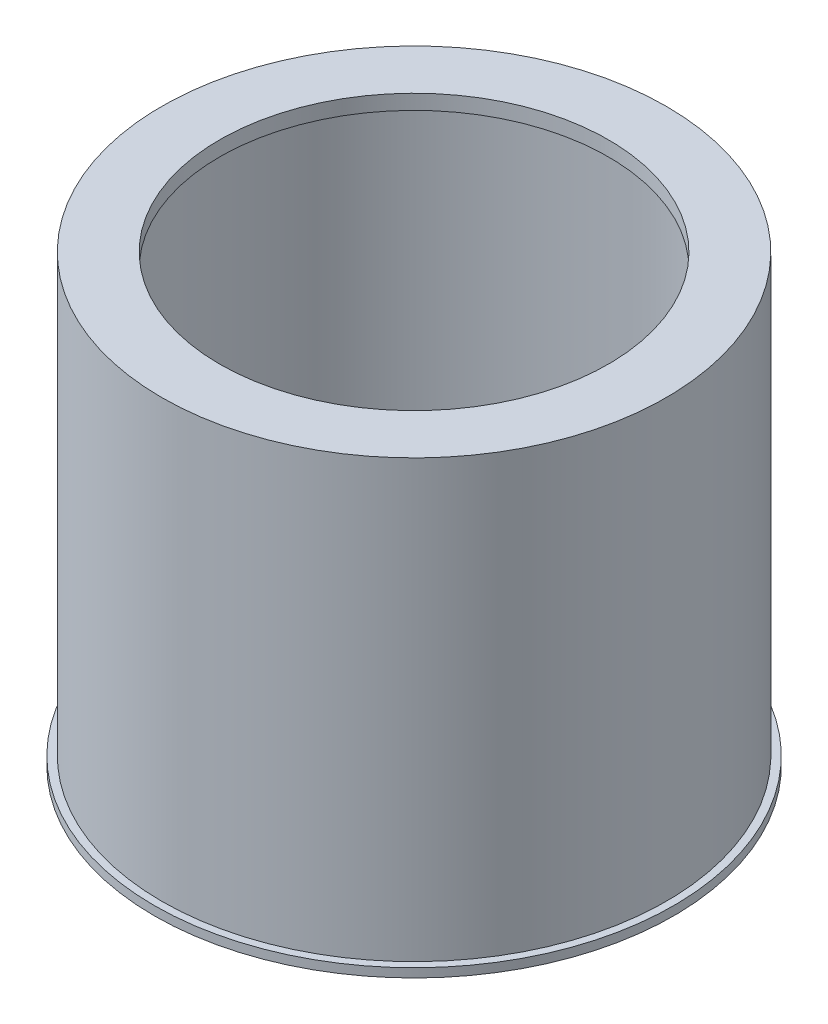
from build123d import *

# Parameters (mm, degrees)
RECEPTACLE_FLOOR_SKETCH_R   = 175
RECEPTACLE_FLOOR_SKETCH_R_2 = 12.5
RECEPTACLE_FLOOR_DEPTH      = 6
RECEPTACLE_WALL_SKETCH_R    = 170
RECEPTACLE_WALL_SKETCH_R_2  = 166
RECEPTACLE_WALL_DEPTH       = 300
POT_START                   = 290
POT_SEAT_LEDGE_SKETCH_R     = 167
POT_SEAT_LEDGE_SKETCH_R_2   = 131
POT_SEAT_LEDGE_DEPTH        = 10


with BuildPart() as part:
    # Receptacle Floor Sketch → Receptacle Floor (new body)
    with BuildSketch(Plane(origin=(0, 0, 0), x_dir=(1, 0, 0), z_dir=(0, 1, 0))):
        Circle(RECEPTACLE_FLOOR_SKETCH_R)
        Circle(RECEPTACLE_FLOOR_SKETCH_R_2, mode=Mode.SUBTRACT)
    extrude(amount=RECEPTACLE_FLOOR_DEPTH)

    # Receptacle Wall Sketch → Receptacle Wall (add)
    with BuildSketch(Plane(origin=(0, 0, 0), x_dir=(1, 0, 0), z_dir=(0, 1, 0))):
        Circle(RECEPTACLE_WALL_SKETCH_R)
        Circle(RECEPTACLE_WALL_SKETCH_R_2, mode=Mode.SUBTRACT)
    extrude(amount=RECEPTACLE_WALL_DEPTH)

    # Pot Seat Ledge Sketch → Pot Seat Ledge (add)
    with BuildSketch(Plane(origin=(0, 0, 0), x_dir=(1, 0, 0), z_dir=(0, 1, 0)).offset(POT_START)):
        Circle(POT_SEAT_LEDGE_SKETCH_R)
        Circle(POT_SEAT_LEDGE_SKETCH_R_2, mode=Mode.SUBTRACT)
    extrude(amount=POT_SEAT_LEDGE_DEPTH)


solid = part.part
